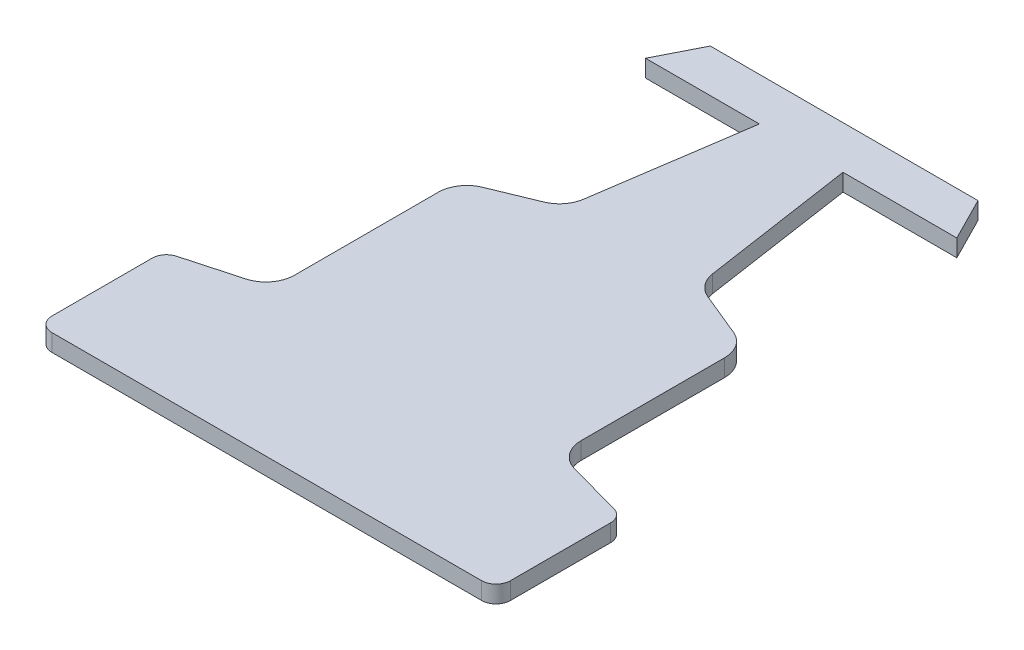
from build123d import *

# Parameters (mm, degrees)
BOSS_EXTRUDE2_DEPTH = 6


with BuildPart() as part:
    # Sketch1 → Boss-Extrude2 (new body)
    with BuildSketch(Plane(origin=(0, 0, 0), x_dir=(1, 0, 0), z_dir=(0, 1, 0))):
        with BuildLine():
            Line((-57.34406126, -32.025727864), (-76.32796937, -37.255567224))
            ThreePointArc((-76.32796937, -37.255567224), (-78.977426734, -39.046128123), (-80, -42.075992242))
            Line((-80, -42.075992242), (-80, -77.075992242))
            ThreePointArc((-80, -77.075992242), (-78.535533906, -80.611526148), (-75, -82.075992242))
            Line((-75, -82.075992242), (75, -82.075992242))
            ThreePointArc((75, -82.075992242), (78.535533906, -80.611526148), (80, -77.075992242))
            Line((80, -77.075992242), (80, -42.075992242))
            ThreePointArc((80, -42.075992242), (78.977426734, -39.046128123), (76.32796937, -37.255567224))
            Line((76.32796937, -37.255567224), (57.34406126, -32.025727864))
            ThreePointArc((57.34406126, -32.025727864), (52.045146532, -28.444606065), (50, -22.384877828))
            Line((50, -22.384877828), (50, 27.723001492))
            ThreePointArc((50, 27.723001492), (48.308817369, 33.287491939), (43.807289214, 36.969868466))
            Line((43.807289214, 36.969868466), (28.617300766, 43.224168366))
            ThreePointArc((28.617300766, 43.224168366), (24.548426853, 46.309375305), (22.533202362, 51.001188071))
            Line((22.533202362, 51.001188071), (14.595223026, 104.420092305))
            Line((14.595223026, 104.420092305), (54.320631323, 104.420092305))
            Line((54.320631323, 104.420092305), (46.70776039, 119.420092305))
            Line((46.70776039, 119.420092305), (-46.70776039, 119.420092305))
            Line((-46.70776039, 119.420092305), (-54.320631323, 104.420092305))
            Line((-54.320631323, 104.420092305), (-14.595223026, 104.420092305))
            Line((-14.595223026, 104.420092305), (-22.533202362, 51.001188071))
            ThreePointArc((-22.533202362, 51.001188071), (-24.548426853, 46.309375305), (-28.617300766, 43.224168366))
            Line((-28.617300766, 43.224168366), (-43.807289214, 36.969868466))
            ThreePointArc((-43.807289214, 36.969868466), (-48.308817369, 33.287491939), (-50, 27.723001492))
            Line((-50, 27.723001492), (-50, -22.384877828))
            ThreePointArc((-50, -22.384877828), (-52.045146532, -28.444606065), (-57.34406126, -32.025727864))
        make_face()
    extrude(amount=BOSS_EXTRUDE2_DEPTH)


solid = part.part
